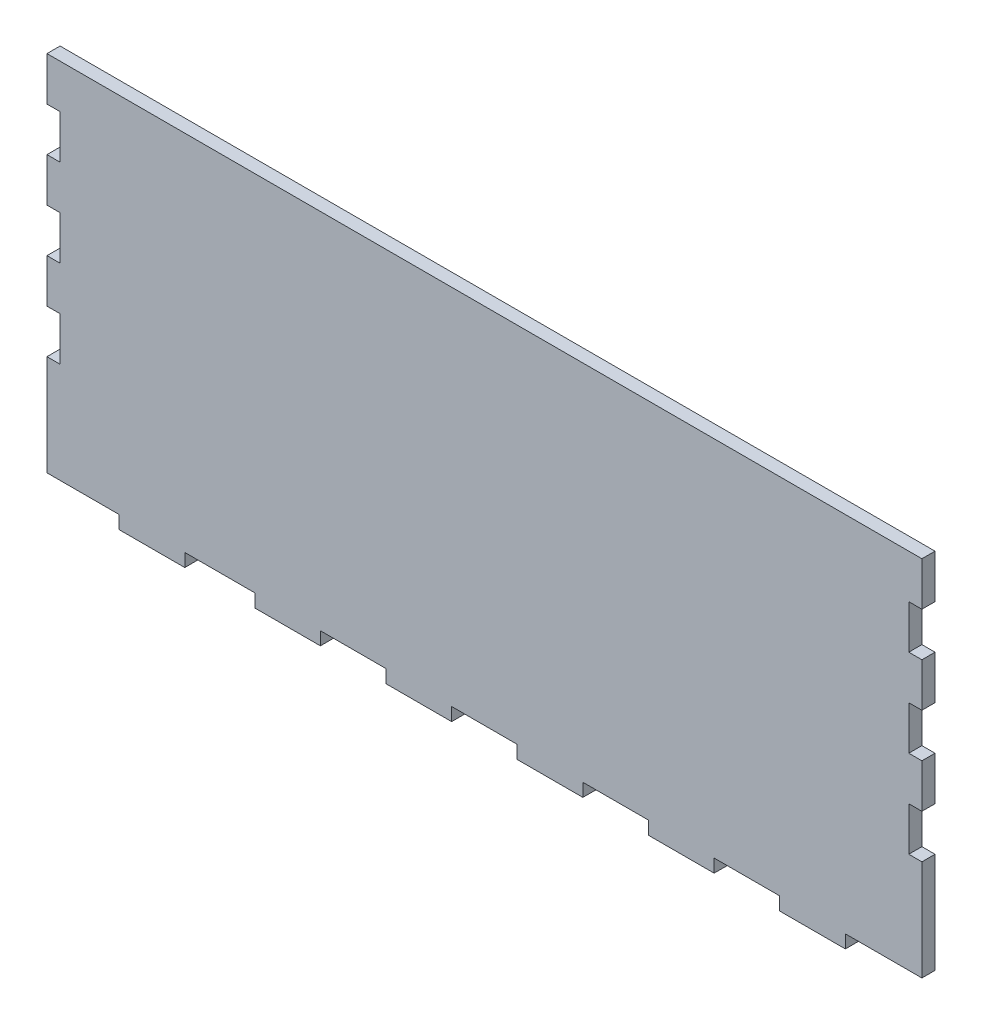
from build123d import *

# Parameters (mm, degrees)
BOSS_EXTRUDE1_DEPTH = 3


with BuildPart() as part:
    # Sketch1 → Boss-Extrude1 (new body)
    with BuildSketch(Plane.XY):
        Polygon((100, -2.5), (97, -2.5), (97, 7.5), (100, 7.5), (100, 17.5), (97, 17.5), (97, 27.5), (100, 27.5), (100, 37.5), (97, 37.5), (97, 47.5), (100, 47.5), (100, 57.5), (97, 57.5), (-97, 57.5), (-100, 57.5), (-100, 47.5), (-97, 47.5), (-97, 37.5), (-100, 37.5), (-100, 27.5), (-97, 27.5), (-97, 17.5), (-100, 17.5), (-100, 7.5), (-97, 7.5), (-97, -2.5), (-100, -2.5), (-100, -25.5), (-97, -25.5), (-83.5, -25.5), (-83.5, -28.5), (-68.5, -28.5), (-68.5, -25.5), (-52.5, -25.5), (-52.5, -28.5), (-37.5, -28.5), (-37.5, -25.5), (-22.5, -25.5), (-22.5, -28.5), (-7.5, -28.5), (-7.5, -25.5), (0, -25.5), (7.5, -25.5), (7.5, -28.5), (22.5, -28.5), (22.5, -25.5), (30, -25.5), (37.5, -25.5), (37.5, -28.5), (52.5, -28.5), (52.5, -25.5), (60, -25.5), (67.5, -25.5), (67.5, -28.5), (82.5, -28.5), (82.5, -25.5), (97, -25.5), (100, -25.5), align=None)
    extrude(amount=BOSS_EXTRUDE1_DEPTH)


solid = part.part
